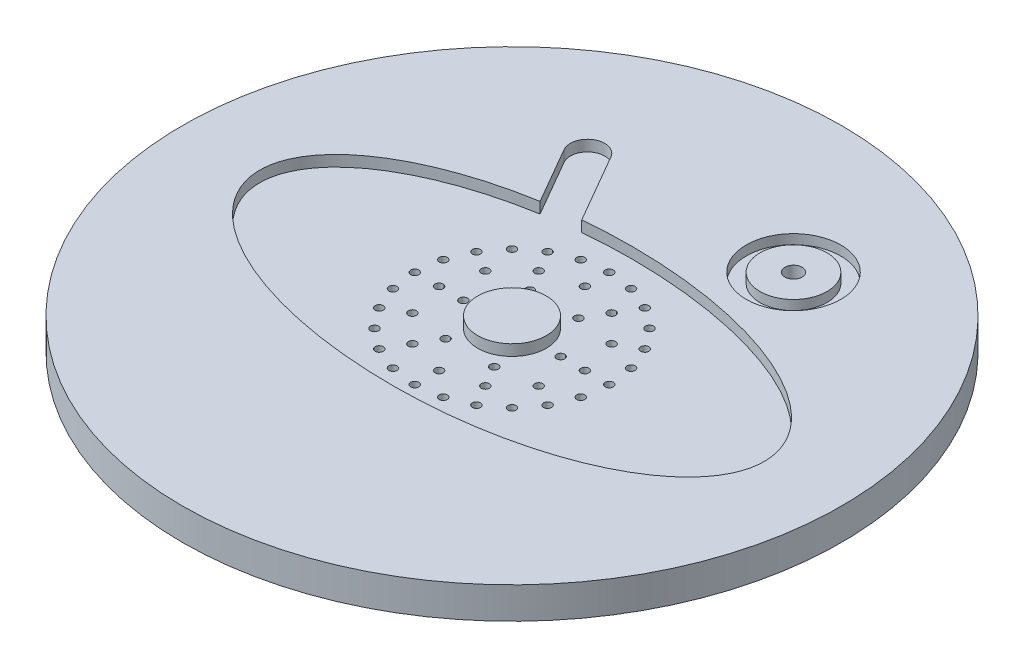
from build123d import *

# Parameters (mm, degrees)
SKETCH1_R                       = 60.96
BILLET_DEPTH                    = 5.842
SKETCH4_R                       = 0.7493
FIRST_KEROSENE_OUTLET_DEPTH     = 88.140881336
PRIMARY_HOLES_COUNT             = 6
SECOND_START                    = -5.842
SECOND_RING_OUTLINE_R           = 0.7493
SECOND_RING_DEPTH               = 5.842
THIRD_START                     = -5.842
THIRD_RING_OUTLINE_R            = 0.7493
THIRD_RING_DEPTH                = 5.842
SKETCH18_RX                     = 46.67504
SKETCH18_RY                     = 22.225
KEROSENE_WELL_DEPTH             = 2.032
SKETCH17_R                      = 6.35
BOSS_EXTRUDE1_DEPTH             = 2.54
BOSS_EXTRUDE1_DIRECTION_2_REACH = 88.408
SKETCH21_R                      = 6.35
CUT_EXTRUDE1_DEPTH              = 2.54
CUT_EXTRUDE2_DEPTH              = 2.032
F_1_8_0_125_DIAMETER_HOLE2_D    = 3.175
SKETCH31_R                      = 8.740396603
SKETCH31_R_2                    = 6.200396603
CUT_EXTRUDE4_DEPTH              = 1.778
SKETCH32_R                      = 55.7149
SKETCH32_R_2                    = 51.6509
CUT_EXTRUDE5_DEPTH              = 2.6924


# Read off the part's stored shape, not the designer's step: Second ring, Third Ring
with BuildPart() as part:
    # Sketch1 → Billet (new body)
    with BuildSketch(Plane(origin=(0, 0, 0), x_dir=(1, 0, 0), z_dir=(0, 1, 0))):
        with Locations(Location((0, 0, 0), (0, 0, 270))):
            Circle(SKETCH1_R)
    extrude(amount=-BILLET_DEPTH)

    # Sketch4 → First Kerosene Outlet (cut, symmetric)
    with BuildSketch(Plane(origin=(0, -12.7, 0), x_dir=(1, 0, 0), z_dir=(0, 1, 0))):
        with Locations(Location((8.9916, 0, 0), (0, 0, 270))):
            Circle(SKETCH4_R)
        with Locations(Location((13.4874, 0, 0), (0, 0, 270))):
            Circle(SKETCH4_R)
        with Locations(Location((17.9832, 0, 0), (0, 0, 270))):
            Circle(SKETCH4_R)
    first_kerosene_outlet = extrude(amount=FIRST_KEROSENE_OUTLET_DEPTH, both=True, mode=Mode.SUBTRACT)

    # Primary Holes: First Kerosene Outlet ×6 about axis
    primary_holes_axis = Axis((0, 0, 0), (0, 1, 0))
    for i in range(1, PRIMARY_HOLES_COUNT):
        add(first_kerosene_outlet.rotate(primary_holes_axis, i * 360 / PRIMARY_HOLES_COUNT), mode=Mode.SUBTRACT)

    # Second ring outline → Second ring (cut)
    with BuildSketch(Plane(origin=(0, 0, 0), x_dir=(1, 0, 0), z_dir=(0, 1, 0)).offset(SECOND_START)):
        with Locations((11.680431031, 6.7437)):
            Circle(SECOND_RING_OUTLINE_R)
        with Locations((0, 13.4874)):
            Circle(SECOND_RING_OUTLINE_R)
        with Locations((-11.680431031, 6.7437)):
            Circle(SECOND_RING_OUTLINE_R)
        with Locations((-11.680431031, -6.7437)):
            Circle(SECOND_RING_OUTLINE_R)
        with Locations((0, -13.4874)):
            Circle(SECOND_RING_OUTLINE_R)
        with Locations((11.680431031, -6.7437)):
            Circle(SECOND_RING_OUTLINE_R)
    extrude(amount=SECOND_RING_DEPTH, mode=Mode.SUBTRACT)

    # Third Ring outline → Third Ring (cut)
    with BuildSketch(Plane(origin=(0, 0, 0), x_dir=(1, 0, 0), z_dir=(0, 1, 0)).offset(THIRD_START)):
        with Locations((17.370437319, 4.654394652)):
            Circle(THIRD_RING_OUTLINE_R)
        with Locations((15.573908041, 8.9916)):
            Circle(THIRD_RING_OUTLINE_R)
        with Locations((12.716042667, 12.716042667)):
            Circle(THIRD_RING_OUTLINE_R)
        with Locations((4.654394652, 17.370437319)):
            Circle(THIRD_RING_OUTLINE_R)
        with Locations((0, 17.9832)):
            Circle(THIRD_RING_OUTLINE_R)
        with Locations((-4.654394652, 17.370437319)):
            Circle(THIRD_RING_OUTLINE_R)
        with Locations((-12.716042667, 12.716042667)):
            Circle(THIRD_RING_OUTLINE_R)
        with Locations((-15.573908041, 8.9916)):
            Circle(THIRD_RING_OUTLINE_R)
        with Locations((-17.370437319, 4.654394652)):
            Circle(THIRD_RING_OUTLINE_R)
        with Locations((-17.370437319, -4.654394652)):
            Circle(THIRD_RING_OUTLINE_R)
        with Locations((-15.573908041, -8.9916)):
            Circle(THIRD_RING_OUTLINE_R)
        with Locations((-12.716042667, -12.716042667)):
            Circle(THIRD_RING_OUTLINE_R)
        with Locations((-4.654394652, -17.370437319)):
            Circle(THIRD_RING_OUTLINE_R)
        with Locations((0, -17.9832)):
            Circle(THIRD_RING_OUTLINE_R)
        with Locations((4.654394652, -17.370437319)):
            Circle(THIRD_RING_OUTLINE_R)
        with Locations((12.716042667, -12.716042667)):
            Circle(THIRD_RING_OUTLINE_R)
        with Locations((15.573908041, -8.9916)):
            Circle(THIRD_RING_OUTLINE_R)
        with Locations((17.370437319, -4.654394652)):
            Circle(THIRD_RING_OUTLINE_R)
    extrude(amount=THIRD_RING_DEPTH, mode=Mode.SUBTRACT)

    # Sketch18 → Kerosene Well (cut)
    with BuildSketch(Plane(origin=(0, 0, 0), x_dir=(1, 0, 0), z_dir=(0, 1, 0))):
        with Locations(Location((0, 0), (0, 0, -180))):
            Ellipse(SKETCH18_RX, SKETCH18_RY)
    extrude(amount=-KEROSENE_WELL_DEPTH, mode=Mode.SUBTRACT)

    # Sketch17 → Boss-Extrude1 (add)
    with BuildSketch(Plane(origin=(0, 0, 0), x_dir=(1, 0, 0), z_dir=(0, 1, 0))):
        with Locations(Location((0, 0, 0), (0, 0, 270))):
            Circle(SKETCH17_R)
    extrude(amount=BOSS_EXTRUDE1_DEPTH)

    # Sketch17 → Boss-Extrude1 direction 2 (add, up to next)
    with BuildSketch(Plane(origin=(0, 0, 0), x_dir=(1, 0, 0), z_dir=(0, 1, 0)), mode=Mode.PRIVATE) as boss_extrude1_direction_2_sk1:
        with Locations(Location((0, 0, 0), (0, 0, 270))):
            Circle(SKETCH17_R)
    boss_extrude1_direction_2_tool1 = extrude(boss_extrude1_direction_2_sk1.sketch, amount=-BOSS_EXTRUDE1_DIRECTION_2_REACH, mode=Mode.PRIVATE) - part.part
    add(boss_extrude1_direction_2_tool1.solids().sort_by_distance((0, 0, 0))[0])

    # Sketch21 → Cut-Extrude1 (cut)
    with BuildSketch(Plane(origin=(0, 2.54, 0), x_dir=(1, 0, 0), z_dir=(0, 1, 0))):
        with Locations(Location((0, 0, 0), (0, 0, 270))):
            Circle(SKETCH21_R)
    extrude(amount=-CUT_EXTRUDE1_DEPTH, mode=Mode.SUBTRACT)

    # Sketch24 → Cut-Extrude2 (cut)
    with BuildSketch(Plane(origin=(0, 0, 0), x_dir=(1, 0, 0), z_dir=(0, 1, 0))):
        with BuildLine():
            Line((-15.732765962, 20.924382105), (-21.799630657, 31.4325))
            ThreePointArc((-21.799630657, 31.4325), (-20.6375, 35.769630657), (-16.300369343, 34.6075))
            Line((-16.300369343, 34.6075), (-8.915091663, 21.81582383))
            add(Edge.make_bspline(
                [(-8.915091663, 21.81582383), (-12.395027666, 21.493390748), (-15.732765962, 20.924382105)],
                knots=[4.904573252, 4.904573252, 4.904573252, 5.056192247, 5.056192247, 5.056192247], degree=2, weights=[1, 0.997127836, 1]))
        make_face()
    extrude(amount=-CUT_EXTRUDE2_DEPTH, mode=Mode.SUBTRACT)

    # 1/8 (0.125) Diameter Hole2 (through all)
    with Locations(Plane(origin=(19.05, 0, -33.02), x_dir=(0, 0, 1), z_dir=(0, 1, 0))):
        with Locations((0, 0)):
            Hole(F_1_8_0_125_DIAMETER_HOLE2_D / 2)

    # Sketch31 → Cut-Extrude4 (cut)
    with BuildSketch(Plane(origin=(0, 0, 0), x_dir=(1, 0, 0), z_dir=(0, 1, 0))):
        with Locations(Location((19.05, 33.02, 0), (0, 0, 270))):
            Circle(SKETCH31_R)
        with Locations(Location((19.05, 33.02, 0), (0, 0, 270))):
            Circle(SKETCH31_R_2, mode=Mode.SUBTRACT)
    extrude(amount=-CUT_EXTRUDE4_DEPTH, mode=Mode.SUBTRACT)

    # Sketch32 → Cut-Extrude5 (cut)
    with BuildSketch(Plane.XZ.offset(5.842)):
        with Locations(Location((0, 0, 0), (0, 0, 270))):
            Circle(SKETCH32_R)
        with Locations(Location((0, 0, 0), (0, 0, 270))):
            Circle(SKETCH32_R_2, mode=Mode.SUBTRACT)
    extrude(amount=-CUT_EXTRUDE5_DEPTH, mode=Mode.SUBTRACT)


solid = part.part
